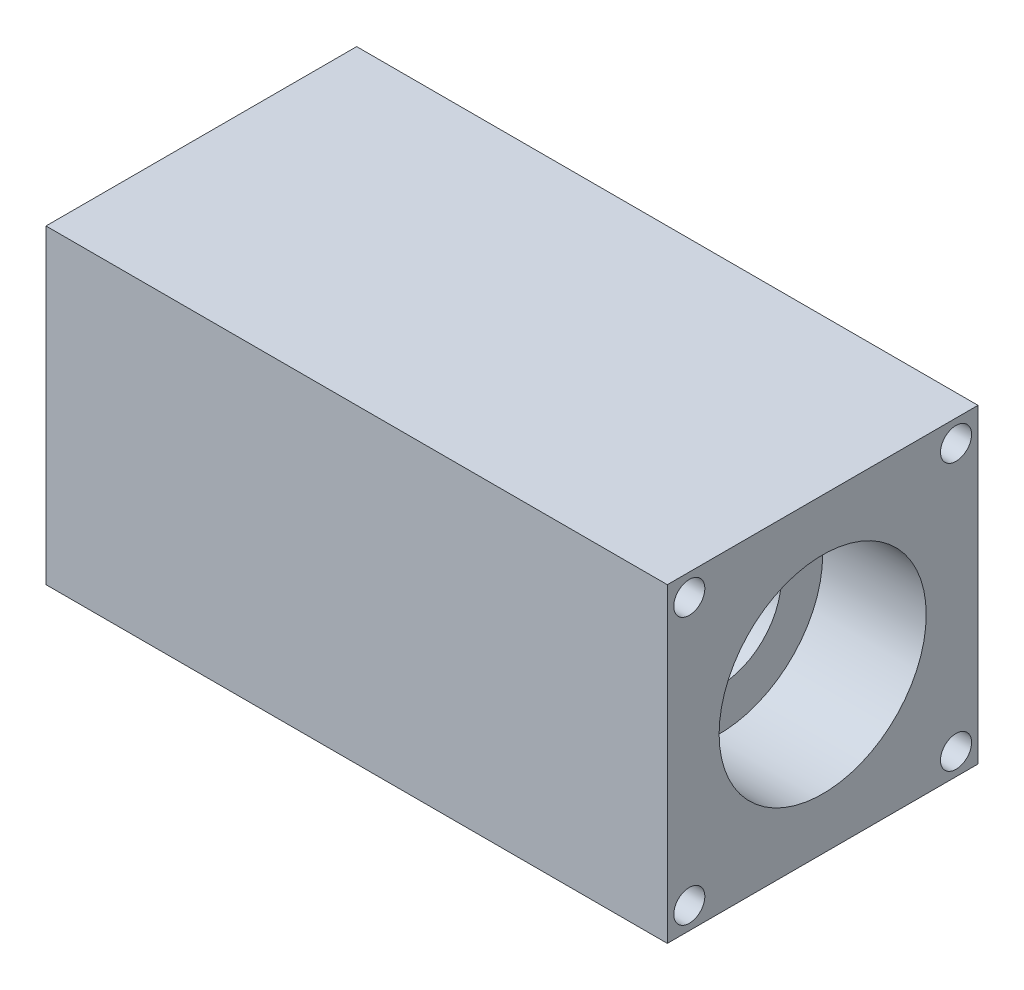
from build123d import *

# Parameters (mm, degrees)
SKETCH1_W           = 60
SKETCH1_H           = 30
BOSS_EXTRUDE1_DEPTH = 30
SKETCH2_R           = 6
CUT_EXTRUDE1_DEPTH  = 74.484692283
SKETCH2_4_R         = 10
SKETCH2_4_R_2       = 6
CUT_EXTRUDE2_DEPTH  = 10
SKETCH5_R           = 1.5
CUT_EXTRUDE4_DEPTH  = 10
SKETCH6_R           = 6.5944
CUT_EXTRUDE5_DEPTH  = 15


with BuildPart() as part:
    # Sketch1 → Boss-Extrude1 (new body)
    with BuildSketch(Plane(origin=(0, 0, 0), x_dir=(1, 0, 0), z_dir=(0, 1, 0))):
        with Locations((30, 15)):
            Rectangle(SKETCH1_W, SKETCH1_H)
    extrude(amount=BOSS_EXTRUDE1_DEPTH)

    # Sketch2 → Cut-Extrude1 (cut, through all)
    with BuildSketch(Plane.ZY):
        with Locations((-15, 15)):
            Circle(SKETCH2_R)
    extrude(amount=-CUT_EXTRUDE1_DEPTH, mode=Mode.SUBTRACT)

    # Sketch2<4> → Cut-Extrude2 (cut)
    with BuildSketch(Plane.ZY):
        with Locations((-15, 15)):
            Circle(SKETCH2_4_R)
        with Locations((-15, 15)):
            Circle(SKETCH2_4_R_2, mode=Mode.SUBTRACT)
    cut_extrude2 = extrude(amount=-CUT_EXTRUDE2_DEPTH, mode=Mode.SUBTRACT)

    # Mirror1: Cut-Extrude2 across plane
    add(cut_extrude2.mirror(Plane.ZY.offset(-30)), mode=Mode.SUBTRACT)

    # Sketch5 → Cut-Extrude4 (cut)
    with BuildSketch(Plane.ZY):
        with Locations((-27.878679656, 27.878679656)):
            Circle(SKETCH5_R)
        with Locations((-2.121320344, 2.121320344)):
            Circle(SKETCH5_R)
        with Locations((-2.121320344, 27.878679656)):
            Circle(SKETCH5_R)
        with Locations((-27.878679656, 2.121320344)):
            Circle(SKETCH5_R)
    cut_extrude4 = extrude(amount=-CUT_EXTRUDE4_DEPTH, mode=Mode.SUBTRACT)

    # Mirror2: Cut-Extrude4 across plane
    add(cut_extrude4.mirror(Plane.ZY.offset(-30)), mode=Mode.SUBTRACT)

    # Sketch6 → Cut-Extrude5 (cut)
    with BuildSketch(Plane(origin=(0, 0, -30), x_dir=(-1, 0, 0), z_dir=(0, 0, -1))):
        with Locations((-30, 15)):
            Circle(SKETCH6_R)
    extrude(amount=-CUT_EXTRUDE5_DEPTH, mode=Mode.SUBTRACT)


solid = part.part
